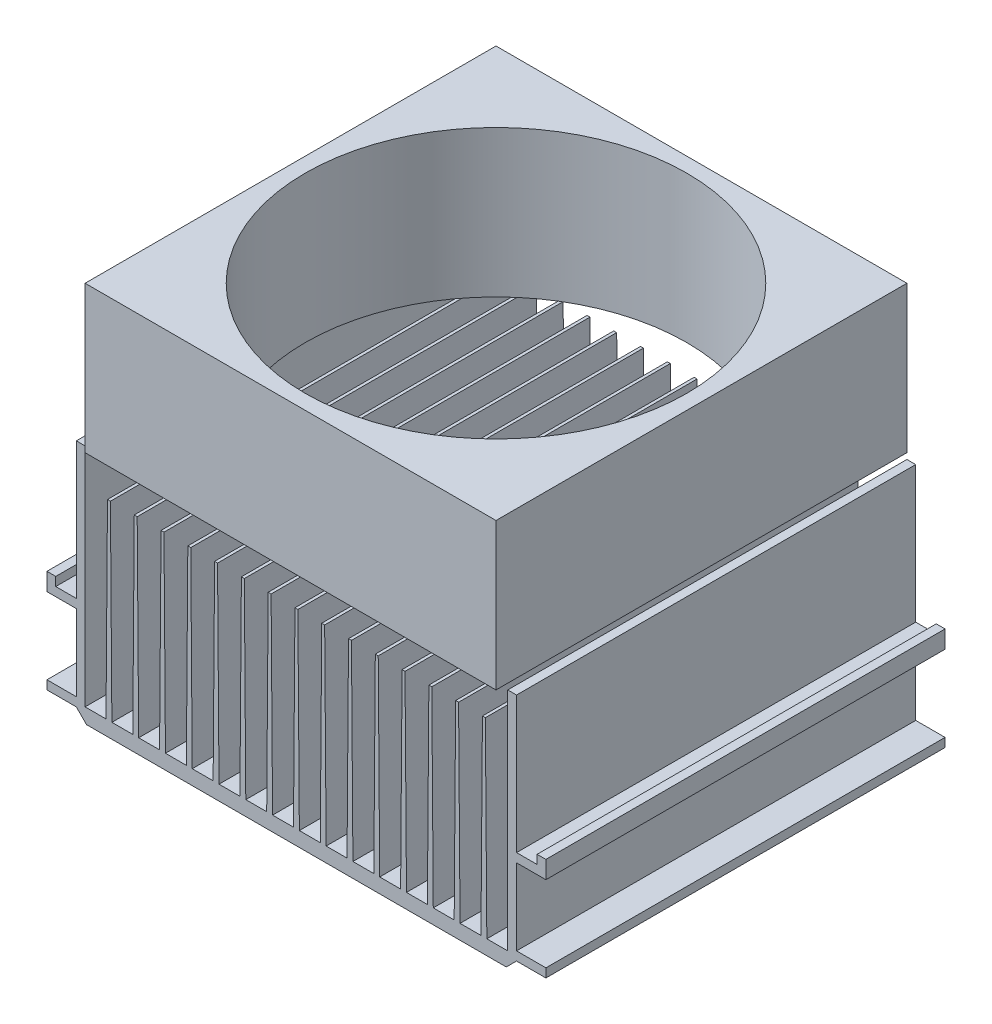
from build123d import *

# Parameters (mm, degrees)
HEATSINK_DEPTH = 68
SKETCH3_R      = 32.5
FAN_DEPTH      = 25


with BuildPart() as part:
    # Sketch1 → Heatsink (new body)
    with BuildSketch(Plane.XY):
        Polygon((-35.75, 0), (35.75, 0), (37.5, 1.75), (42.5, 1.75), (42.5, 3.25), (37.5, 3.25), (37.5, 16.25), (42.5, 16.25), (42.5, 19.25), (41, 19.25), (41, 17.75), (37.5, 17.75), (37.5, 41), (36, 41), (36, 2.5), (32.4375, 2.5), (32.1875, 35), (31.6875, 35), (31.4375, 2.5), (27.875, 2.5), (27.625, 35), (27.125, 35), (26.875, 2.5), (23.3125, 2.5), (23.0625, 35), (22.5625, 35), (22.3125, 2.5), (18.75, 2.5), (18.5, 35), (18, 35), (17.75, 2.5), (14.1875, 2.5), (13.9375, 35), (13.4375, 35), (13.1875, 2.5), (9.625, 2.5), (9.375, 35), (8.875, 35), (8.625, 2.5), (5.0625, 2.5), (4.8125, 35), (4.3125, 35), (4.0625, 2.5), (0.5, 2.5), (0.25, 35), (-0.25, 35), (-0.5, 2.5), (-4.0625, 2.5), (-4.3125, 35), (-4.8125, 35), (-5.0625, 2.5), (-8.625, 2.5), (-8.875, 35), (-9.375, 35), (-9.625, 2.5), (-13.1875, 2.5), (-13.4375, 35), (-13.9375, 35), (-14.1875, 2.5), (-17.75, 2.5), (-18, 35), (-18.5, 35), (-18.75, 2.5), (-22.3125, 2.5), (-22.5625, 35), (-23.0625, 35), (-23.3125, 2.5), (-26.875, 2.5), (-27.125, 35), (-27.625, 35), (-27.875, 2.5), (-31.4375, 2.5), (-31.6875, 35), (-32.1875, 35), (-32.4375, 2.5), (-36, 2.5), (-36, 41), (-37.5, 41), (-37.5, 17.75), (-41, 17.75), (-41, 19.25), (-42.5, 19.25), (-42.5, 16.25), (-37.5, 16.25), (-37.5, 3.25), (-42.5, 3.25), (-42.5, 1.75), (-37.5, 1.75), align=None)
    extrude(amount=-HEATSINK_DEPTH)


with BuildPart() as body_2:
    # Sketch3 → Fan (new body)
    with BuildSketch(Plane(origin=(0, 41, 0), x_dir=(1, 0, 0), z_dir=(0, 1, 0))):
        Polygon((-35, 69), (35, 69), (35, -1), (0, -1), (-35, -1), align=None)
        with Locations((0, 34)):
            Circle(SKETCH3_R, mode=Mode.SUBTRACT)
    extrude(amount=FAN_DEPTH)


solid = Compound([part.part, body_2.part])
